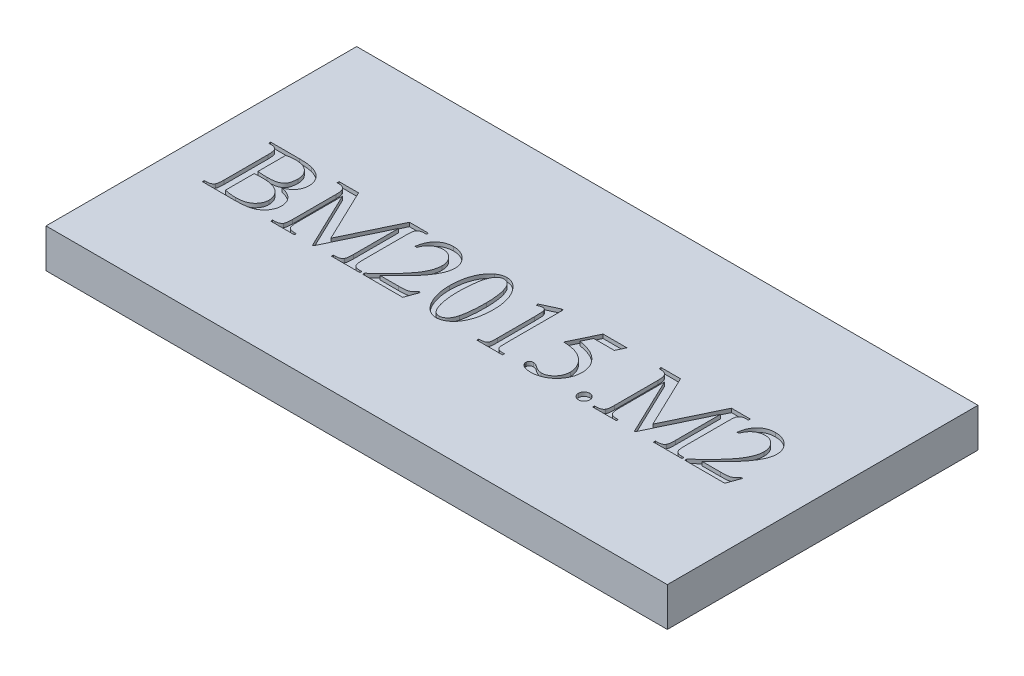
from build123d import *

# Parameters (mm, degrees)
SKETCH_1_W          = 160
SKETCH_1_H          = 80
EXTRUDE_1_DEPTH     = 10
CUT_EXTRUDE_1_DEPTH = 1


with BuildPart() as part:
    # Эскиз1 → Бобышка-Вытянуть1 (new body)
    with BuildSketch(Plane(origin=(0, 0, 0), x_dir=(1, 0, 0), z_dir=(0, 1, 0))):
        Rectangle(SKETCH_1_W, SKETCH_1_H)
    extrude(amount=EXTRUDE_1_DEPTH)

    # Эскиз2 → Вырез-Вытянуть1 (cut)
    # profile 1 of 9: a face of its own
    with BuildSketch(Plane(origin=(0, 10, 0), x_dir=(1, 0, 0), z_dir=(0, 1, 0))):
        with BuildLine():
            add(Edge.make_bspline(
                [(-58.083307054, -1.12936359), (-57.935151583, -1.162218616), (-57.647224583, -1.226069441), (-57.233701046, -1.344617735), (-56.85051146, -1.47956541), (-56.493404032, -1.623649358), (-56.164474978, -1.783325876), (-55.864999545, -1.959081857), (-55.595654967, -2.150476291), (-55.433679051, -2.291199058), (-55.354468452, -2.360016293)],
                knots=[0, 0, 0, 0, 1.202298385, 2.336560135, 3.406084711, 4.420247637, 5.386399354, 6.300522109, 7.168909389, 8, 8, 8, 8], degree=3))
            add(Edge.make_bspline(
                [(-55.354468452, -2.360016293), (-55.254240258, -2.45868109), (-55.056391441, -2.653443788), (-54.800647537, -2.975704736), (-54.585222065, -3.31438968), (-54.407168596, -3.668692158), (-54.270098938, -4.040713305), (-54.169543605, -4.428340837), (-54.111729232, -4.832307411), (-54.104533282, -5.106509479), (-54.100884332, -5.245552911)],
                knots=[0, 0, 0, 0, 1.040892545, 2.054704896, 3.038886078, 4.009403739, 4.985637774, 5.96968326, 6.970459233, 8, 8, 8, 8], degree=3))
            add(Edge.make_bspline(
                [(-54.100884332, -5.245552911), (-54.109773906, -5.459326742), (-54.127634896, -5.888842475), (-54.295807273, -6.522135238), (-54.552689425, -7.143512483), (-54.912842113, -7.737821359), (-55.35300588, -8.29336594), (-55.890156435, -8.76594946), (-56.496512251, -9.163913784), (-57.062965395, -9.427120756), (-57.567328024, -9.591580546), (-57.996528063, -9.700807422), (-58.471665181, -9.79862292), (-58.995936524, -9.865487586), (-59.565085802, -9.929753148), (-60.182391491, -9.968570826), (-60.846269083, -9.997197456), (-61.305134604, -9.999045516), (-61.542129093, -10)],
                knots=[0, 0, 0, 0, 1.028770293, 2.067011775, 3.138033473, 4.261901228, 5.406207792, 6.541562624, 7.694800496, 8.892876887, 9.539626609, 10.250184141, 11.027081459, 11.876550478, 12.796927842, 13.788050093, 14.85757392, 16, 16, 16, 16], degree=3))
            Line((-61.542129093, -10), (-69.75539822, -10))
            Line((-69.75539822, -10), (-69.75539822, -9.510796441))
            Line((-69.75539822, -9.510796441), (-69.117140452, -9.510796441))
            add(Edge.make_bspline(
                [(-69.117140452, -9.510796441), (-69.031623978, -9.508896469), (-68.866223486, -9.505221663), (-68.628601462, -9.468555371), (-68.407591735, -9.418383705), (-68.208553017, -9.33583787), (-68.025639816, -9.235762485), (-67.860349201, -9.114310171), (-67.716452197, -8.965560139), (-67.636649307, -8.85326698), (-67.596023136, -8.796100616)],
                knots=[0, 0, 0, 0, 1.166786496, 2.256723755, 3.277842578, 4.25348796, 5.187934752, 6.120436128, 7.043148905, 8, 8, 8, 8], degree=3))
            add(Edge.make_bspline(
                [(-67.596023136, -8.796100616), (-67.571713165, -8.752126879), (-67.519273623, -8.65727022), (-67.465120099, -8.488517952), (-67.415028953, -8.29096451), (-67.378860094, -8.059207847), (-67.348406901, -7.795301677), (-67.326671955, -7.498195236), (-67.310194933, -7.169426686), (-67.309659765, -6.939953985), (-67.309380425, -6.820176866)],
                knots=[0, 0, 0, 0, 0.597321695, 1.288494999, 2.101981578, 3.025155317, 4.079375286, 5.266669335, 6.573292293, 8, 8, 8, 8], degree=3))
            Line((-67.309380425, -6.820176866), (-67.309380425, 4.431504991))
            add(Edge.make_bspline(
                [(-67.309380425, 4.431504991), (-67.309187714, 4.564044157), (-67.308820582, 4.816542143), (-67.331060069, 5.175734867), (-67.353432169, 5.49775157), (-67.397357301, 5.780488463), (-67.445093055, 6.026200292), (-67.503113973, 6.234101896), (-67.579857841, 6.40226176), (-67.643258386, 6.494765474), (-67.672461192, 6.537373437)],
                knots=[0, 0, 0, 0, 1.467983741, 2.79662948, 3.986363477, 5.042318655, 5.964098798, 6.759038926, 7.428403245, 8, 8, 8, 8], degree=3))
            add(Edge.make_bspline(
                [(-67.672461192, 6.537373437), (-67.75871544, 6.62793383), (-67.93276243, 6.810669917), (-68.27906898, 6.993817977), (-68.679994602, 7.101831697), (-68.966045307, 7.115110536), (-69.117140452, 7.122124566)],
                knots=[0, 0, 0, 0, 0.927123666, 1.870784184, 2.875324672, 4, 4, 4, 4], degree=3))
            Line((-69.117140452, 7.122124566), (-69.75539822, 7.122124566))
            Line((-69.75539822, 7.122124566), (-69.75539822, 7.611328125))
            Line((-69.75539822, 7.611328125), (-62.321797265, 7.611328125))
            add(Edge.make_bspline(
                [(-62.321797265, 7.611328125), (-61.991696852, 7.608620798), (-61.366532154, 7.603493494), (-60.480230914, 7.540198231), (-59.694905134, 7.449140638), (-59.211425828, 7.343516417), (-58.985276116, 7.294110192)],
                knots=[0, 0, 0, 0, 1.179035714, 2.232931189, 3.173445281, 4, 4, 4, 4], degree=3))
            add(Edge.make_bspline(
                [(-58.985276116, 7.294110192), (-58.830475378, 7.252962713), (-58.528036356, 7.172571601), (-58.094236564, 7.017852333), (-57.687918639, 6.842263366), (-57.308550965, 6.64475572), (-56.960169398, 6.420895489), (-56.635313397, 6.180274305), (-56.341120668, 5.912497706), (-56.077791535, 5.621954778), (-55.845558733, 5.314460125), (-55.635433656, 4.998206342), (-55.46620313, 4.664377227), (-55.321125295, 4.323333768), (-55.216617894, 3.968594551), (-55.133743431, 3.605365528), (-55.088177792, 3.228770232), (-55.082276671, 2.974197134), (-55.07929145, 2.845415327)],
                knots=[0, 0, 0, 0, 1.197163213, 2.33893505, 3.43955965, 4.504702612, 5.532566955, 6.532694419, 7.523891994, 8.501634608, 9.459882266, 10.403051993, 11.336018195, 12.25408421, 13.170072591, 14.09679423, 15.037218469, 16, 16, 16, 16], degree=3))
            add(Edge.make_bspline(
                [(-55.07929145, 2.845415327), (-55.087105251, 2.626697856), (-55.102503874, 2.195672354), (-55.254775946, 1.570239949), (-55.494999798, 0.980157447), (-55.769984581, 0.520936195), (-56.040008985, 0.18304697), (-56.260992368, -0.061223322), (-56.510751786, -0.280656081), (-56.780704725, -0.486435746), (-57.075219861, -0.671124202), (-57.389016851, -0.845114708), (-57.727138198, -0.997833345), (-57.962993001, -1.084932594), (-58.083307054, -1.12936359)],
                knots=[0, 0, 0, 0, 1.471082931, 2.899056279, 4.307818116, 5.751614296, 6.484736272, 7.219614112, 7.967209451, 8.720692231, 9.503935749, 10.306636219, 11.136182697, 12, 12, 12, 12], degree=3))
        make_face()
        with BuildLine():
            add(Edge.make_bspline(
                [(-64.86336263, -0.514037238), (-64.692945887, -0.544093737), (-64.330720479, -0.607979641), (-63.74976447, -0.665695354), (-63.104427144, -0.699142348), (-62.653075855, -0.703077259), (-62.417344835, -0.705132378)],
                knots=[0, 0, 0, 0, 0.844887106, 1.795830451, 2.848809897, 4, 4, 4, 4], degree=3))
            add(Edge.make_bspline(
                [(-62.417344835, -0.705132378), (-62.264458487, -0.703354118), (-61.968755926, -0.699914726), (-61.540241642, -0.682406439), (-61.141479761, -0.646432822), (-60.77225986, -0.603915856), (-60.432400817, -0.539958425), (-60.120906283, -0.471510955), (-59.83948761, -0.381490273), (-59.509469981, -0.253532815), (-59.145320321, -0.055754639), (-58.782767834, 0.249409046), (-58.5028781, 0.615111097), (-58.309990283, 1.035402248), (-58.185415618, 1.49099766), (-58.082207176, 1.965085911), (-58.025496826, 2.460574051), (-58.018212998, 2.796874932), (-58.014512804, 2.967716217)],
                knots=[0, 0, 0, 0, 1.091830023, 2.111744693, 3.061402081, 3.95056914, 4.764258185, 5.530001833, 6.226288629, 6.871621508, 8.056545267, 9.166642, 10.231067328, 11.317616446, 12.446050905, 13.598649409, 14.780110772, 16, 16, 16, 16], degree=3))
            add(Edge.make_bspline(
                [(-58.014512804, 2.967716217), (-58.018532349, 3.100348912), (-58.026450031, 3.361608221), (-58.078788197, 3.746816082), (-58.17745199, 4.11571906), (-58.305925913, 4.471005959), (-58.472293973, 4.812706909), (-58.678876152, 5.1359246), (-58.923389495, 5.44449433), (-59.199645402, 5.737669378), (-59.513245855, 6.006493611), (-59.863872586, 6.240298016), (-60.246837904, 6.439488964), (-60.665050033, 6.600434926), (-61.115481955, 6.726083784), (-61.601863798, 6.812476281), (-62.120568156, 6.866431758), (-62.478357766, 6.873761667), (-62.661946615, 6.877522786)],
                knots=[0, 0, 0, 0, 0.932104058, 1.836054539, 2.724128921, 3.610577454, 4.48739039, 5.388899496, 6.300486582, 7.250348221, 8.215526472, 9.196272454, 10.205292906, 11.242666987, 12.339557976, 13.48617357, 14.710106481, 16, 16, 16, 16], degree=3))
            add(Edge.make_bspline(
                [(-62.661946615, 6.877522786), (-62.860795409, 6.873608591), (-63.249040527, 6.865966266), (-63.816627037, 6.813568002), (-64.353439342, 6.719038008), (-64.695808207, 6.625292952), (-64.86336263, 6.579414368)],
                knots=[0, 0, 0, 0, 1.070391011, 2.089899941, 3.065202048, 4, 4, 4, 4], degree=3))
            Line((-64.86336263, 6.579414368), (-64.86336263, -0.514037238))
        make_face(mode=Mode.SUBTRACT)
        with BuildLine():
            add(Edge.make_bspline(
                [(-64.86336263, -8.910757701), (-64.61299155, -8.966180517), (-64.114860083, -9.076448239), (-63.363817105, -9.184042878), (-62.617351025, -9.252129061), (-62.121930429, -9.261511361), (-61.874634637, -9.266194661)],
                knots=[0, 0, 0, 0, 1.019899824, 2.029164851, 3.016231376, 4, 4, 4, 4], degree=3))
            add(Edge.make_bspline(
                [(-61.874634637, -9.266194661), (-61.683369781, -9.264270033), (-61.312764466, -9.260540768), (-60.774376461, -9.2029356), (-60.270130022, -9.1230579), (-59.801690352, -9.002553889), (-59.365782736, -8.856219159), (-58.968358656, -8.667884751), (-58.604287484, -8.448091229), (-58.275754279, -8.197059756), (-57.988329946, -7.917211908), (-57.731150394, -7.625922238), (-57.51743584, -7.314627966), (-57.338767101, -6.989153368), (-57.205635762, -6.643858337), (-57.105081161, -6.286025716), (-57.046688177, -5.909925052), (-57.039679488, -5.654695807), (-57.036105686, -5.524551815)],
                knots=[0, 0, 0, 0, 1.335369974, 2.58748639, 3.778398001, 4.898614871, 5.962444548, 6.985554789, 7.963871145, 8.928614683, 9.866425566, 10.762210136, 11.638554271, 12.498661649, 13.349744001, 14.217688406, 15.091181162, 16, 16, 16, 16], degree=3))
            add(Edge.make_bspline(
                [(-57.036105686, -5.524551815), (-57.044261503, -5.352107441), (-57.060606005, -5.006523727), (-57.16883186, -4.492320686), (-57.362031352, -3.993866839), (-57.61631526, -3.505399873), (-57.950977807, -3.043834451), (-58.380301928, -2.636913587), (-58.88735204, -2.276838993), (-59.479994141, -1.978732112), (-60.147210303, -1.733123454), (-60.891331413, -1.559195298), (-61.708700466, -1.456962118), (-62.278174481, -1.445100422), (-62.57404285, -1.438937717)],
                knots=[0, 0, 0, 0, 0.80426076, 1.611762754, 2.437163379, 3.29025987, 4.174362993, 5.081949637, 6.03643416, 7.064744133, 8.166225842, 9.344998398, 10.620602567, 12, 12, 12, 12], degree=3))
            add(Edge.make_bspline(
                [(-62.57404285, -1.438937717), (-62.702722848, -1.438160339), (-62.951191532, -1.436659297), (-63.309109527, -1.447026636), (-63.637907963, -1.452656868), (-64.017637519, -1.468393209), (-64.424649074, -1.488178676), (-64.72856052, -1.536142157), (-64.86336263, -1.557416704)],
                knots=[0, 0, 0, 0, 1.009225997, 1.948718216, 2.808291512, 3.588270035, 4.930259813, 6, 6, 6, 6], degree=3))
            Line((-64.86336263, -1.557416704), (-64.86336263, -8.910757701))
        make_face(mode=Mode.SUBTRACT)
    # profile 2 of 9: a face of its own
    with BuildSketch(Plane(origin=(0, 10, 0), x_dir=(1, 0, 0), z_dir=(0, 1, 0))):
        with BuildLine():
            Line((-41.381591797, -10), (-48.475043403, 4.817517175))
            Line((-48.475043403, 4.817517175), (-48.475043403, -6.820176866))
            add(Edge.make_bspline(
                [(-48.475043403, -6.820176866), (-48.475224162, -6.955261145), (-48.475567139, -7.211573693), (-48.453681123, -7.57589808), (-48.429942711, -7.901426525), (-48.390519157, -8.186701203), (-48.348683291, -8.434798906), (-48.286350012, -8.639672396), (-48.221565226, -8.809918629), (-48.159424357, -8.900159771), (-48.13107215, -8.941332923)],
                knots=[0, 0, 0, 0, 1.48973486, 2.826663046, 4.025252461, 5.088590954, 6.003687083, 6.795186099, 7.45029523, 8, 8, 8, 8], degree=3))
            add(Edge.make_bspline(
                [(-48.13107215, -8.941332923), (-48.044633234, -9.029283516), (-47.868608314, -9.208386828), (-47.515174715, -9.388466568), (-47.099129811, -9.495079221), (-46.799236034, -9.505357239), (-46.640530056, -9.510796441)],
                knots=[0, 0, 0, 0, 0.893460505, 1.819450328, 2.846037184, 4, 4, 4, 4], degree=3))
            Line((-46.640530056, -9.510796441), (-46.029025608, -9.510796441))
            Line((-46.029025608, -9.510796441), (-46.029025608, -10))
            Line((-46.029025608, -10), (-52.144070095, -10))
            Line((-52.144070095, -10), (-52.144070095, -9.510796441))
            Line((-52.144070095, -9.510796441), (-51.532565647, -9.510796441))
            add(Edge.make_bspline(
                [(-51.532565647, -9.510796441), (-51.444512528, -9.508874283), (-51.274061196, -9.505153411), (-51.028740976, -9.468702177), (-50.802097877, -9.418104563), (-50.595868322, -9.33937337), (-50.40809511, -9.241570039), (-50.241366342, -9.118046394), (-50.09860767, -8.969822735), (-50.017862565, -8.859503545), (-49.977051205, -8.803744422)],
                knots=[0, 0, 0, 0, 1.182386838, 2.288838982, 3.326958154, 4.296765023, 5.246416275, 6.164047556, 7.072046332, 8, 8, 8, 8], degree=3))
            add(Edge.make_bspline(
                [(-49.977051205, -8.803744422), (-49.954270382, -8.762227325), (-49.904120352, -8.670830994), (-49.848621244, -8.508339338), (-49.805341866, -8.310440578), (-49.762452009, -8.080093594), (-49.732410828, -7.813218108), (-49.716775585, -7.513311385), (-49.698335248, -7.178367859), (-49.698149942, -6.943784475), (-49.6980523, -6.820176866)],
                knots=[0, 0, 0, 0, 0.561580455, 1.236271222, 2.028879402, 2.966584022, 4.017422664, 5.2149421, 6.532486222, 8, 8, 8, 8], degree=3))
            Line((-49.6980523, -6.820176866), (-49.6980523, 4.431504991))
            add(Edge.make_bspline(
                [(-49.6980523, 4.431504991), (-49.699976551, 4.621522776), (-49.703548912, 4.9742897), (-49.753858364, 5.459502225), (-49.825140608, 5.863803464), (-49.914062291, 6.093672525), (-49.954119788, 6.197224087)],
                knots=[0, 0, 0, 0, 1.269100049, 2.356076937, 3.259444487, 4, 4, 4, 4], degree=3))
            add(Edge.make_bspline(
                [(-49.954119788, 6.197224087), (-49.987685313, 6.26097027), (-50.056737383, 6.392110954), (-50.203440631, 6.567260268), (-50.390281442, 6.72258539), (-50.614620977, 6.867275248), (-50.898281446, 6.988835152), (-51.251189315, 7.067655514), (-51.673881339, 7.116087696), (-51.979566908, 7.120012469), (-52.144070095, 7.122124566)],
                knots=[0, 0, 0, 0, 0.685675889, 1.410594349, 2.160436148, 2.996293973, 3.94870651, 5.086176952, 6.431940446, 8, 8, 8, 8], degree=3))
            Line((-52.144070095, 7.122124566), (-52.144070095, 7.611328125))
            Line((-52.144070095, 7.611328125), (-47.129733615, 7.611328125))
            Line((-47.129733615, 7.611328125), (-40.578992208, -6.071083917))
            Line((-40.578992208, -6.071083917), (-34.0282508, 7.611328125))
            Line((-34.0282508, 7.611328125), (-29.151502821, 7.611328125))
            Line((-29.151502821, 7.611328125), (-29.151502821, 7.122124566))
            Line((-29.151502821, 7.122124566), (-29.751541562, 7.122124566))
            add(Edge.make_bspline(
                [(-29.751541562, 7.122124566), (-29.840881134, 7.120293258), (-30.012630645, 7.116772686), (-30.260326634, 7.079476113), (-30.488561493, 7.030130603), (-30.69581301, 6.950585862), (-30.88386158, 6.853113694), (-31.050378351, 6.728114751), (-31.197076831, 6.582509492), (-31.277924441, 6.471044301), (-31.318521712, 6.415072547)],
                knots=[0, 0, 0, 0, 1.192663738, 2.292818382, 3.341598875, 4.305885976, 5.250132179, 6.162540657, 7.077327887, 8, 8, 8, 8], degree=3))
            add(Edge.make_bspline(
                [(-31.318521712, 6.415072547), (-31.341302535, 6.37355545), (-31.391452565, 6.282159119), (-31.446951673, 6.119667463), (-31.49023105, 5.921768703), (-31.533120908, 5.691421719), (-31.563162089, 5.424546233), (-31.578797332, 5.12463951), (-31.597237669, 4.789695984), (-31.597422974, 4.5551126), (-31.597520616, 4.431504991)],
                knots=[0, 0, 0, 0, 0.561580455, 1.236271222, 2.028879402, 2.966584022, 4.017422664, 5.2149421, 6.532486222, 8, 8, 8, 8], degree=3))
            Line((-31.597520616, 4.431504991), (-31.597520616, -6.820176866))
            add(Edge.make_bspline(
                [(-31.597520616, -6.820176866), (-31.597683342, -6.955257386), (-31.597992101, -7.211562802), (-31.576334729, -7.575934845), (-31.551860101, -7.901309842), (-31.514693869, -8.187303867), (-31.465886306, -8.4341995), (-31.406224026, -8.640621855), (-31.336310192, -8.810298427), (-31.27166525, -8.900195792), (-31.242083655, -8.941332923)],
                knots=[0, 0, 0, 0, 1.486776415, 2.821049613, 4.017258766, 5.078485589, 5.994452933, 6.784380121, 7.443731031, 8, 8, 8, 8], degree=3))
            add(Edge.make_bspline(
                [(-31.242083655, -8.941332923), (-31.155718913, -9.029440256), (-30.979052652, -9.209671132), (-30.624150738, -9.386686811), (-30.209129193, -9.495788696), (-29.910324729, -9.505588745), (-29.751541562, -9.510796441)],
                knots=[0, 0, 0, 0, 0.893634595, 1.828003868, 2.845812335, 4, 4, 4, 4], degree=3))
            Line((-29.751541562, -9.510796441), (-29.151502821, -9.510796441))
            Line((-29.151502821, -9.510796441), (-29.151502821, -10))
            Line((-29.151502821, -10), (-36.489556207, -10))
            Line((-36.489556207, -10), (-36.489556207, -9.510796441))
            Line((-36.489556207, -9.510796441), (-35.878051758, -9.510796441))
            add(Edge.make_bspline(
                [(-35.878051758, -9.510796441), (-35.788729236, -9.508908991), (-35.617012503, -9.505280493), (-35.370318142, -9.468915019), (-35.142892304, -9.417114805), (-34.935344757, -9.341362154), (-34.749116434, -9.240317632), (-34.583127351, -9.11807279), (-34.440165821, -8.970838698), (-34.361884496, -8.859638089), (-34.322537316, -8.803744422)],
                knots=[0, 0, 0, 0, 1.198333024, 2.303717216, 3.340834392, 4.325725627, 5.259386468, 6.176132048, 7.08325442, 8, 8, 8, 8], degree=3))
            add(Edge.make_bspline(
                [(-34.322537316, -8.803744422), (-34.299756493, -8.762227325), (-34.249606463, -8.670830994), (-34.194107355, -8.508339338), (-34.150827978, -8.310440578), (-34.10793812, -8.080093594), (-34.077896939, -7.813218108), (-34.062261696, -7.513311385), (-34.043821359, -7.178367859), (-34.043636054, -6.943784475), (-34.043538411, -6.820176866)],
                knots=[0, 0, 0, 0, 0.561580455, 1.236271222, 2.028879402, 2.966584022, 4.017422664, 5.2149421, 6.532486222, 8, 8, 8, 8], degree=3))
            Line((-34.043538411, -6.820176866), (-34.043538411, 4.817517175))
            Line((-34.043538411, 4.817517175), (-41.136990017, -10))
            Line((-41.136990017, -10), (-41.381591797, -10))
        make_face()
    # profile 3 of 9: a face of its own
    with BuildSketch(Plane(origin=(0, 10, 0), x_dir=(1, 0, 0), z_dir=(0, 1, 0))):
        with BuildLine():
            Line((-16.921413845, -6.625259823), (-18.14060084, -10))
            Line((-18.14060084, -10), (-28.417697483, -10))
            Line((-28.417697483, -10), (-28.417697483, -9.522262149))
            add(Edge.make_bspline(
                [(-28.417697483, -9.522262149), (-28.049962701, -9.184284741), (-27.337208561, -8.529207198), (-26.317028371, -7.564400857), (-25.382387985, -6.646322311), (-24.533063777, -5.775332429), (-23.768274698, -4.952023491), (-23.089825636, -4.173799915), (-22.492136687, -3.447487308), (-21.977980964, -2.7593731), (-21.531297964, -2.10503188), (-21.152910225, -1.4657044), (-20.830235974, -0.8421502), (-20.56276819, -0.233347909), (-20.359861129, 0.364295092), (-20.213485834, 0.946947654), (-20.120603261, 1.514976731), (-20.107610584, 1.889612186), (-20.101236979, 2.073390961)],
                knots=[0, 0, 0, 0, 1.640196139, 3.179075376, 4.61094688, 5.942305235, 7.173872596, 8.30065911, 9.332401675, 10.262017718, 11.120692698, 11.932909408, 12.700076558, 13.425218913, 14.114511764, 14.770003029, 15.396620544, 16, 16, 16, 16], degree=3))
            add(Edge.make_bspline(
                [(-20.101236979, 2.073390961), (-20.10370474, 2.209869651), (-20.108542321, 2.477410385), (-20.160291182, 2.868665388), (-20.240869872, 3.241830458), (-20.349058871, 3.598074853), (-20.498284173, 3.932849655), (-20.671406647, 4.252011432), (-20.886201144, 4.547209051), (-21.124060691, 4.824611076), (-21.385867657, 5.074798563), (-21.66300152, 5.293732585), (-21.950447126, 5.483527854), (-22.252568271, 5.63743977), (-22.569317732, 5.751446209), (-22.8967657, 5.835682054), (-23.237044746, 5.892573979), (-23.469376136, 5.896919264), (-23.586812337, 5.899115668)],
                knots=[0, 0, 0, 0, 1.134419306, 2.223815103, 3.275304008, 4.307399035, 5.313221346, 6.318597171, 7.32112197, 8.342723066, 9.354331769, 10.327252885, 11.276405737, 12.214555788, 13.139633085, 14.069852934, 15.024371439, 16, 16, 16, 16], degree=3))
            add(Edge.make_bspline(
                [(-23.586812337, 5.899115668), (-23.799140972, 5.891013996), (-24.21725078, 5.875060479), (-24.824863941, 5.726892013), (-25.399228557, 5.491312143), (-25.934481849, 5.162069128), (-26.419679188, 4.742389989), (-26.841795751, 4.233577877), (-27.192538134, 3.635052479), (-27.360368563, 3.192275286), (-27.44693417, 2.963894314)],
                knots=[0, 0, 0, 0, 0.978774112, 1.927366301, 2.868767021, 3.835023234, 4.81480387, 5.817007219, 6.874029602, 8, 8, 8, 8], degree=3))
            Line((-27.44693417, 2.963894314), (-27.928493924, 2.963894314))
            add(Edge.make_bspline(
                [(-27.928493924, 2.963894314), (-27.899622971, 3.155558226), (-27.843215303, 3.53002853), (-27.710501317, 4.069536579), (-27.55258225, 4.576946559), (-27.355519174, 5.046960457), (-27.134390838, 5.487427775), (-26.878727441, 5.892127147), (-26.590404285, 6.263183943), (-26.267732069, 6.594806512), (-25.922030566, 6.893128235), (-25.552086656, 7.149704246), (-25.163924952, 7.372048836), (-24.75043071, 7.544532532), (-24.318708276, 7.684835618), (-23.866697178, 7.782294838), (-23.393748217, 7.846687545), (-23.07107543, 7.85280833), (-22.906513638, 7.855929905)],
                knots=[0, 0, 0, 0, 1.200501633, 2.345523519, 3.439068721, 4.490246694, 5.499995932, 6.48995494, 7.451685612, 8.406391985, 9.352574024, 10.27676432, 11.192316343, 12.119031984, 13.047762957, 14.001652993, 14.980851257, 16, 16, 16, 16], degree=3))
            add(Edge.make_bspline(
                [(-22.906513638, 7.855929905), (-22.73182676, 7.850989345), (-22.389023402, 7.841294053), (-21.884418405, 7.780738851), (-21.402400767, 7.672808773), (-20.940193943, 7.525111162), (-20.504405459, 7.327144342), (-20.087066374, 7.094731764), (-19.696360766, 6.811978979), (-19.330096058, 6.49413165), (-18.993587465, 6.149570204), (-18.704831758, 5.78041709), (-18.45035961, 5.402142391), (-18.254061616, 5.00159255), (-18.094499051, 4.58903364), (-17.97912917, 4.161582388), (-17.913606904, 3.716294331), (-17.904466544, 3.415089713), (-17.899820964, 3.262002733)],
                knots=[0, 0, 0, 0, 1.109419983, 2.177111989, 3.221343547, 4.242152537, 5.252521162, 6.255999647, 7.270763728, 8.308866099, 9.333003754, 10.32358272, 11.281716678, 12.222409134, 13.149434629, 14.0874794, 15.027963099, 16, 16, 16, 16], degree=3))
            add(Edge.make_bspline(
                [(-17.899820964, 3.262002733), (-17.906885075, 3.039774486), (-17.921112713, 2.592190497), (-18.047207343, 1.924911451), (-18.240045278, 1.255752628), (-18.42972743, 0.825529217), (-18.526613024, 0.605780284)],
                knots=[0, 0, 0, 0, 0.968670703, 1.950973842, 2.953401185, 4, 4, 4, 4], degree=3))
            add(Edge.make_bspline(
                [(-18.526613024, 0.605780284), (-18.610913654, 0.428757641), (-18.78282303, 0.067765657), (-19.09080369, -0.462221098), (-19.425703527, -1.004892836), (-19.797131775, -1.55723393), (-20.209623466, -2.114039465), (-20.664047598, -2.675068601), (-21.147386427, -3.250337108), (-21.49228952, -3.627566572), (-21.668217129, -3.819983164)],
                knots=[0, 0, 0, 0, 0.863272392, 1.760421205, 2.69783519, 3.672094839, 4.691137575, 5.748887515, 6.851756197, 8, 8, 8, 8], degree=3))
            add(Edge.make_bspline(
                [(-21.668217129, -3.819983164), (-21.927939485, -4.087678129), (-22.42227903, -4.597192247), (-23.128719542, -5.320150772), (-23.76605255, -5.961921808), (-24.325096361, -6.532859337), (-24.817766094, -7.021209511), (-25.239043973, -7.430554108), (-25.585947855, -7.764045295), (-25.79563336, -7.958083803), (-25.887597826, -8.043185764)],
                knots=[0, 0, 0, 0, 1.49931882, 2.853711152, 4.0632012, 5.135089847, 6.065735724, 6.851603135, 7.496332836, 8, 8, 8, 8], degree=3))
            Line((-25.887597826, -8.043185764), (-21.236342112, -8.043185764))
            add(Edge.make_bspline(
                [(-21.236342112, -8.043185764), (-21.017197625, -8.041745886), (-20.614485178, -8.039099883), (-20.062671956, -8.020081787), (-19.617193774, -7.993814419), (-19.26163778, -7.948212422), (-18.965908948, -7.880166739), (-18.699841131, -7.788563046), (-18.446139388, -7.673131375), (-18.20829291, -7.525869003), (-17.981817191, -7.351223065), (-17.774103175, -7.139737641), (-17.576851451, -6.900284294), (-17.466993092, -6.718530088), (-17.410617405, -6.625259823)],
                knots=[0, 0, 0, 0, 1.821637222, 3.347544769, 4.589491042, 5.530053278, 6.323823777, 7.107498442, 7.865641253, 8.635746017, 9.428031577, 10.236778878, 11.095173072, 12, 12, 12, 12], degree=3))
            Line((-17.410617405, -6.625259823), (-16.921413845, -6.625259823))
        make_face()
    # profile 4 of 9: a face of its own
    with BuildSketch(Plane(origin=(0, 10, 0), x_dir=(1, 0, 0), z_dir=(0, 1, 0))):
        with BuildLine():
            add(Edge.make_bspline(
                [(-14.71999783, -1.324280633), (-14.716463312, -1.079638546), (-14.709518908, -0.598980708), (-14.67262676, 0.108899861), (-14.60431309, 0.791361978), (-14.503987398, 1.446363769), (-14.382160885, 2.07666124), (-14.234859207, 2.681014159), (-14.054194106, 3.258475859), (-13.849054524, 3.808627234), (-13.617551902, 4.327053844), (-13.377520059, 4.818453922), (-13.105963534, 5.269500413), (-12.825737006, 5.69007838), (-12.526766354, 6.07700528), (-12.20291243, 6.422727906), (-11.869948706, 6.744886236), (-11.626237937, 6.928284061), (-11.505777571, 7.01893319)],
                knots=[0, 0, 0, 0, 1.267948223, 2.491187271, 3.672419621, 4.820944812, 5.924168987, 6.998668076, 8.042818115, 9.058224754, 10.039662809, 10.984530588, 11.890392543, 12.765710998, 13.603053422, 14.420720048, 15.219399938, 16, 16, 16, 16], degree=3))
            add(Edge.make_bspline(
                [(-11.505777571, 7.01893319), (-11.31960454, 7.147533712), (-10.959488199, 7.396286979), (-10.372000283, 7.657086086), (-9.77728641, 7.823851146), (-9.374209431, 7.845298919), (-9.17441686, 7.855929905)],
                knots=[0, 0, 0, 0, 1.076116545, 2.081542914, 3.049081206, 4, 4, 4, 4], degree=3))
            add(Edge.make_bspline(
                [(-9.17441686, 7.855929905), (-9.012134387, 7.850469588), (-8.689784333, 7.839623479), (-8.213989406, 7.739147568), (-7.751420934, 7.577555408), (-7.303044685, 7.349378672), (-6.867223318, 7.059280607), (-6.446228827, 6.703849965), (-6.036030137, 6.287138449), (-5.786625137, 5.972925065), (-5.658266279, 5.811211904)],
                knots=[0, 0, 0, 0, 0.921550053, 1.830522441, 2.751246923, 3.70019056, 4.682375705, 5.720881843, 6.827028318, 8, 8, 8, 8], degree=3))
            add(Edge.make_bspline(
                [(-5.658266279, 5.811211904), (-5.502362148, 5.593641132), (-5.18758535, 5.154356873), (-4.788844756, 4.433668801), (-4.459729993, 3.654101274), (-4.18117436, 2.821983027), (-3.975341736, 1.931822646), (-3.821749089, 0.98724994), (-3.729591723, -0.014085673), (-3.718564491, -0.701116264), (-3.712917752, -1.052925534)],
                knots=[0, 0, 0, 0, 0.883963831, 1.784759013, 2.714530965, 3.677036329, 4.680787027, 5.730006124, 6.837599228, 8, 8, 8, 8], degree=3))
            add(Edge.make_bspline(
                [(-3.712917752, -1.052925534), (-3.71423776, -1.301432704), (-3.716825662, -1.78863558), (-3.763128327, -2.504805296), (-3.823376957, -3.192815174), (-3.922513952, -3.851280557), (-4.037093284, -4.483908971), (-4.188695315, -5.08613273), (-4.357208489, -5.662270482), (-4.562268169, -6.203847093), (-4.78299341, -6.713317505), (-5.014882356, -7.19141007), (-5.268762012, -7.629584918), (-5.530460645, -8.036685463), (-5.809873939, -8.405102838), (-6.105757391, -8.735480764), (-6.415644104, -9.031654013), (-6.74006793, -9.289439494), (-7.067559408, -9.514747915), (-7.39561443, -9.706688045), (-7.718954396, -9.872260638), (-8.041753384, -10.005121572), (-8.358226209, -10.115879236), (-8.67407939, -10.185959839), (-8.985553079, -10.23605179), (-9.193329928, -10.241760953), (-9.29671775, -10.24460178)],
                knots=[0, 0, 0, 0, 1.510050896, 2.960482548, 4.360412811, 5.706191847, 7.006128856, 8.266230485, 9.478809624, 10.652394328, 11.782968825, 12.852979618, 13.879641343, 14.858961868, 15.792780312, 16.68657793, 17.551917979, 18.394760493, 19.202293251, 19.965865945, 20.70343888, 21.408045917, 22.086293389, 22.738035093, 23.372058038, 24, 24, 24, 24], degree=3))
            add(Edge.make_bspline(
                [(-9.29671775, -10.24460178), (-9.496306248, -10.236105273), (-9.891434928, -10.219284598), (-10.469397398, -10.0742171), (-11.022865454, -9.844109964), (-11.545281894, -9.512280361), (-12.042523337, -9.093471148), (-12.514241373, -8.583796591), (-12.95767734, -7.980958563), (-13.217150431, -7.533739377), (-13.351756626, -7.30173662)],
                knots=[0, 0, 0, 0, 0.907345466, 1.796286953, 2.695609492, 3.62566933, 4.601329434, 5.647644493, 6.779674527, 8, 8, 8, 8], degree=3))
            add(Edge.make_bspline(
                [(-13.351756626, -7.30173662), (-13.462040604, -7.091828026), (-13.684726231, -6.667980178), (-13.961211559, -5.997423386), (-14.195380691, -5.294808941), (-14.38350185, -4.560985583), (-14.539434757, -3.797580759), (-14.644672986, -3.002015534), (-14.705447758, -2.17370069), (-14.715086062, -1.611025217), (-14.71999783, -1.324280633)],
                knots=[0, 0, 0, 0, 0.917887123, 1.853399498, 2.805111979, 3.783983157, 4.785434396, 5.820907986, 6.889514713, 8, 8, 8, 8], degree=3))
        make_face()
        with BuildLine():
            add(Edge.make_bspline(
                [(-12.273980035, -1.630032857), (-12.270427448, -1.926895958), (-12.263487061, -2.506852262), (-12.227482365, -3.354829188), (-12.15762883, -4.16042021), (-12.063467509, -4.924335618), (-11.941459916, -5.647492662), (-11.794087266, -6.329409246), (-11.615164062, -6.968446087), (-11.472215616, -7.375041348), (-11.402586195, -7.573091719)],
                knots=[0, 0, 0, 0, 1.180112402, 2.305485676, 3.372849049, 4.393553838, 5.364293091, 6.287088038, 7.165649773, 8, 8, 8, 8], degree=3))
            add(Edge.make_bspline(
                [(-11.402586195, -7.573091719), (-11.342129321, -7.726170833), (-11.226760413, -8.018289315), (-11.010936193, -8.413324186), (-10.779136525, -8.751823689), (-10.51972709, -9.027048437), (-10.240078764, -9.24749024), (-9.931571336, -9.396351967), (-9.604627151, -9.494608491), (-9.377696974, -9.505340201), (-9.262320624, -9.510796441)],
                knots=[0, 0, 0, 0, 1.27796888, 2.438728037, 3.490730404, 4.457262314, 5.368188585, 6.240469892, 7.105415757, 8, 8, 8, 8], degree=3))
            add(Edge.make_bspline(
                [(-9.262320624, -9.510796441), (-9.146753759, -9.503169853), (-8.907288098, -9.487366829), (-8.550213518, -9.359330316), (-8.193443473, -9.15359115), (-7.895187724, -8.932403571), (-7.66776357, -8.707388931), (-7.496172048, -8.513156939), (-7.345818302, -8.283790008), (-7.200685156, -8.032875856), (-7.06541163, -7.754883264), (-6.945653563, -7.45000118), (-6.832627558, -7.118892102), (-6.771518279, -6.886859128), (-6.739864773, -6.766670227)],
                knots=[0, 0, 0, 0, 1.037825602, 2.150474477, 3.371635047, 4.73778764, 5.475301301, 6.247273825, 7.064217381, 7.93705097, 8.854564737, 9.842063216, 10.882227619, 12, 12, 12, 12], degree=3))
            add(Edge.make_bspline(
                [(-6.739864773, -6.766670227), (-6.691984509, -6.570915662), (-6.592086057, -6.162488968), (-6.477333168, -5.516384293), (-6.377190064, -4.814083047), (-6.299684601, -4.053984101), (-6.233777563, -3.236011408), (-6.189418723, -2.361700762), (-6.162067534, -1.430199615), (-6.160001362, -0.790508791), (-6.158935547, -0.460530599)],
                knots=[0, 0, 0, 0, 0.761713504, 1.589256053, 2.479498212, 3.443272477, 4.477217009, 5.58167292, 6.752529866, 8, 8, 8, 8], degree=3))
            add(Edge.make_bspline(
                [(-6.158935547, -0.460530599), (-6.159629382, -0.214612933), (-6.160992469, 0.268509484), (-6.194505273, 0.97695574), (-6.238412856, 1.653864493), (-6.302212834, 2.299253145), (-6.391351118, 2.911944444), (-6.493431397, 3.494930178), (-6.613993289, 4.046400029), (-6.713954078, 4.400095359), (-6.76279619, 4.572915395)],
                knots=[0, 0, 0, 0, 1.160165125, 2.279225349, 3.345596166, 4.360583534, 5.338162882, 6.266121345, 7.152804842, 8, 8, 8, 8], degree=3))
            add(Edge.make_bspline(
                [(-6.76279619, 4.572915395), (-6.801194822, 4.693040211), (-6.875691025, 4.926091294), (-7.00203939, 5.259009709), (-7.135757725, 5.565192264), (-7.275657476, 5.846504952), (-7.430158808, 6.096977413), (-7.584314416, 6.325880344), (-7.754781803, 6.522216837), (-7.876601141, 6.637665072), (-7.936120351, 6.694071452)],
                knots=[0, 0, 0, 0, 1.233545328, 2.393169741, 3.481419258, 4.501374537, 5.463177041, 6.358578008, 7.198024365, 8, 8, 8, 8], degree=3))
            add(Edge.make_bspline(
                [(-7.936120351, 6.694071452), (-8.024343064, 6.760152644), (-8.199996597, 6.891721879), (-8.506354838, 7.025200606), (-8.837527169, 7.107654336), (-9.068174051, 7.117235107), (-9.185882568, 7.122124566)],
                knots=[0, 0, 0, 0, 0.978770933, 1.948756365, 2.953166656, 4, 4, 4, 4], degree=3))
            add(Edge.make_bspline(
                [(-9.185882568, 7.122124566), (-9.326141088, 7.112696826), (-9.607122944, 7.093810103), (-10.010568301, 6.93379536), (-10.387312521, 6.677668922), (-10.599300107, 6.447994887), (-10.710821788, 6.327168783)],
                knots=[0, 0, 0, 0, 0.945219573, 1.893571615, 2.891857598, 4, 4, 4, 4], degree=3))
            add(Edge.make_bspline(
                [(-10.710821788, 6.327168783), (-10.785441112, 6.231751638), (-10.938327755, 6.036252589), (-11.136380874, 5.705511462), (-11.320608916, 5.339968741), (-11.478702142, 4.931451834), (-11.623386436, 4.487327388), (-11.755362842, 4.004767909), (-11.858409166, 3.481613577), (-11.979365136, 2.738224876), (-12.098140853, 1.786537842), (-12.193307188, 0.641310564), (-12.26529688, -0.496570254), (-12.271090348, -1.25282525), (-12.273980035, -1.630032857)],
                knots=[0, 0, 0, 0, 0.529149883, 1.084168889, 1.682003891, 2.317081463, 2.996986461, 3.723908646, 4.502772949, 5.326906926, 7.016784336, 8.694047759, 10.351045161, 12, 12, 12, 12], degree=3))
        make_face(mode=Mode.SUBTRACT)
    # profile 5 of 9: a face of its own
    with BuildSketch(Plane(origin=(0, 10, 0), x_dir=(1, 0, 0), z_dir=(0, 1, 0))):
        with BuildLine():
            Line((0.68991428, 5.899115668), (4.897829268, 7.855929905))
            Line((4.897829268, 7.855929905), (5.33734809, 7.855929905))
            Line((5.33734809, 7.855929905), (5.33734809, -6.820176866))
            add(Edge.make_bspline(
                [(5.33734809, -6.820176866), (5.338865316, -6.94119563), (5.341740078, -7.170495834), (5.342102563, -7.496806078), (5.356987855, -7.785798922), (5.364248378, -8.039794341), (5.386740702, -8.257206428), (5.401639981, -8.441650521), (5.429787182, -8.589065411), (5.462450074, -8.738106942), (5.529761526, -8.890489327), (5.643939018, -9.047332516), (5.791464278, -9.180936335), (5.979239189, -9.301947197), (6.239477109, -9.386931689), (6.584318375, -9.452873892), (7.028274202, -9.495313531), (7.357773249, -9.505307076), (7.538764106, -9.510796441)],
                knots=[0, 0, 0, 0, 1.356933168, 2.571048021, 3.657379777, 4.601012336, 5.418253307, 6.107533085, 6.673460353, 7.099554724, 7.815972102, 8.521630774, 9.259509655, 10.036179522, 11.007509208, 12.304408113, 13.970044684, 16, 16, 16, 16], degree=3))
            Line((7.538764106, -9.510796441), (7.538764106, -10))
            Line((7.538764106, -10), (0.934516059, -10))
            Line((0.934516059, -10), (0.934516059, -9.510796441))
            add(Edge.make_bspline(
                [(0.934516059, -9.510796441), (1.119358656, -9.505547272), (1.454004337, -9.496043987), (1.901259925, -9.451719967), (2.241652704, -9.392437482), (2.491921338, -9.309344095), (2.664750121, -9.191038199), (2.80594145, -9.070495828), (2.913414102, -8.927970171), (2.990251767, -8.795243027), (3.035104864, -8.659344623), (3.057753732, -8.514845002), (3.087031097, -8.331957612), (3.102810184, -8.107006082), (3.118418554, -7.842062283), (3.13053365, -7.537520867), (3.131738522, -7.19216767), (3.134481571, -6.948844414), (3.135932075, -6.820176866)],
                knots=[0, 0, 0, 0, 2.071302469, 3.74996044, 5.029173581, 5.941282905, 6.673651071, 7.361112001, 8.012044112, 8.663601818, 9.069808009, 9.607263055, 10.29959599, 11.144699654, 12.131164582, 13.273777592, 14.558393644, 16, 16, 16, 16], degree=3))
            Line((3.135932075, -6.820176866), (3.135932075, 2.719292535))
            add(Edge.make_bspline(
                [(3.135932075, 2.719292535), (3.13678555, 2.861987852), (3.138416447, 3.134662813), (3.127379242, 3.524408011), (3.123968946, 3.87500229), (3.105095677, 4.18431461), (3.094098672, 4.453703488), (3.0679679, 4.681236189), (3.049663669, 4.87106125), (3.024752406, 4.982011728), (3.013631185, 5.031543732)],
                knots=[0, 0, 0, 0, 1.476765178, 2.821934835, 4.035278551, 5.104597693, 6.029081604, 6.824151588, 7.47506195, 8, 8, 8, 8], degree=3))
            add(Edge.make_bspline(
                [(3.013631185, 5.031543732), (2.997414931, 5.093214322), (2.966676299, 5.210113672), (2.897186859, 5.370584922), (2.808567208, 5.507095778), (2.6680286, 5.65268389), (2.446409033, 5.784375661), (2.247422734, 5.80215508), (2.146059248, 5.811211904)],
                knots=[0, 0, 0, 0, 0.903062441, 1.711795068, 2.468214314, 3.196286531, 4.571790261, 6, 6, 6, 6], degree=3))
            add(Edge.make_bspline(
                [(2.146059248, 5.811211904), (2.062932455, 5.804423211), (1.877726938, 5.789298084), (1.579671072, 5.711948477), (1.23847836, 5.582491261), (1.001238306, 5.470354154), (0.873365614, 5.409912109)],
                knots=[0, 0, 0, 0, 0.743837888, 1.657262055, 2.737261251, 4, 4, 4, 4], degree=3))
            Line((0.873365614, 5.409912109), (0.68991428, 5.899115668))
        make_face()
    # profile 6 of 9: a face of its own
    with BuildSketch(Plane(origin=(0, 10, 0), x_dir=(1, 0, 0), z_dir=(0, 1, 0))):
        with BuildLine():
            Line((21.970269097, 7.611328125), (20.953642951, 5.409912109))
            Line((20.953642951, 5.409912109), (15.637376149, 5.409912109))
            Line((15.637376149, 5.409912109), (14.460230086, 3.009757148))
            add(Edge.make_bspline(
                [(14.460230086, 3.009757148), (14.761661027, 2.964291131), (15.350419236, 2.87548641), (16.198051455, 2.675103694), (16.990825509, 2.431280715), (17.726169497, 2.139103929), (18.402964327, 1.792444081), (19.023926022, 1.40229514), (19.593500616, 0.967975102), (19.925282361, 0.633926847), (20.089892917, 0.468191783)],
                knots=[0, 0, 0, 0, 1.161098856, 2.267870976, 3.314957367, 4.319094488, 5.278631444, 6.207879786, 7.110855526, 8, 8, 8, 8], degree=3))
            add(Edge.make_bspline(
                [(20.089892917, 0.468191783), (20.220147181, 0.321450019), (20.477212108, 0.031845982), (20.809123405, -0.43799232), (21.096285893, -0.924495254), (21.323374981, -1.434835901), (21.507288626, -1.961967627), (21.630293509, -2.50968818), (21.71034884, -3.076179944), (21.720507188, -3.460445979), (21.725667318, -3.655641344)],
                knots=[0, 0, 0, 0, 1.034913379, 2.042466206, 3.030809393, 4.011898082, 4.985794297, 5.972603802, 6.970144889, 8, 8, 8, 8], degree=3))
            add(Edge.make_bspline(
                [(21.725667318, -3.655641344), (21.718975189, -3.881508033), (21.705789245, -4.326548169), (21.603559297, -4.981506069), (21.436732396, -5.611597362), (21.19682578, -6.209332168), (20.911236966, -6.771621303), (20.589464879, -7.295809772), (20.228976893, -7.774851944), (19.834510639, -8.210480223), (19.413312612, -8.604759742), (18.968223843, -8.959002804), (18.497603045, -9.269210592), (18.167618969, -9.445736269), (18.003133986, -9.533727858)],
                knots=[0, 0, 0, 0, 1.1099864, 2.187079908, 3.250539699, 4.307729047, 5.34688064, 6.348023694, 7.327560577, 8.289805641, 9.233611556, 10.160876763, 11.083264383, 12, 12, 12, 12], degree=3))
            add(Edge.make_bspline(
                [(18.003133986, -9.533727858), (17.765868034, -9.642667945), (17.298350274, -9.857327594), (16.564708923, -10.0768505), (15.823686825, -10.217402236), (15.324602215, -10.2355473), (15.075556437, -10.24460178)],
                knots=[0, 0, 0, 0, 1.030129172, 2.029805285, 3.016862743, 4, 4, 4, 4], degree=3))
            add(Edge.make_bspline(
                [(15.075556437, -10.24460178), (14.953167182, -10.243838379), (14.718257811, -10.242373136), (14.378210215, -10.211574477), (14.063252974, -10.178463896), (13.774145215, -10.118239573), (13.510033879, -10.0502513), (13.27514633, -9.953233453), (13.059144453, -9.855964733), (12.822175238, -9.692342567), (12.573705497, -9.478074074), (12.354249866, -9.190767633), (12.209833449, -8.88766913), (12.193999158, -8.675258744), (12.186197917, -8.570608351)],
                knots=[0, 0, 0, 0, 1.193262804, 2.290304112, 3.329214677, 4.279706917, 5.169093206, 5.983709925, 6.756293359, 7.473199502, 8.784894099, 9.938141948, 10.984163348, 12, 12, 12, 12], degree=3))
            add(Edge.make_bspline(
                [(12.186197917, -8.570608351), (12.190091187, -8.512890754), (12.197791305, -8.398736751), (12.253353845, -8.233107595), (12.349726568, -8.082322826), (12.473884502, -7.941453542), (12.629405713, -7.823289086), (12.808467602, -7.740314633), (13.004257024, -7.681617278), (13.142479788, -7.678106847), (13.214289771, -7.676283095)],
                knots=[0, 0, 0, 0, 0.916128209, 1.811920583, 2.738491236, 3.74165137, 4.781681047, 5.813410906, 6.864015437, 8, 8, 8, 8], degree=3))
            add(Edge.make_bspline(
                [(13.214289771, -7.676283095), (13.318047672, -7.680828349), (13.513488268, -7.689389888), (13.7549044, -7.759622314), (13.950860683, -7.855720158), (14.1417893, -7.962883659), (14.373319257, -8.113709349), (14.54077567, -8.228776634), (14.632215712, -8.291609446)],
                knots=[0, 0, 0, 0, 1.184038934, 2.230281013, 2.842640406, 3.677218206, 4.731638514, 6, 6, 6, 6], degree=3))
            add(Edge.make_bspline(
                [(14.632215712, -8.291609446), (14.784135061, -8.392261592), (15.079677663, -8.588069416), (15.548047186, -8.810403991), (16.020026153, -8.963152287), (16.339614664, -9.002284486), (16.497304281, -9.021592882)],
                knots=[0, 0, 0, 0, 1.077967054, 2.097067893, 3.06106564, 4, 4, 4, 4], degree=3))
            add(Edge.make_bspline(
                [(16.497304281, -9.021592882), (16.614722232, -9.017700253), (16.848215694, -9.009959499), (17.191406095, -8.954791111), (17.526148628, -8.86820986), (17.845129088, -8.734617347), (18.158785116, -8.57553016), (18.456691752, -8.372543111), (18.749220002, -8.141223318), (19.020650269, -7.868743243), (19.274325504, -7.577251277), (19.494707509, -7.262857445), (19.682575692, -6.934481452), (19.835988005, -6.588698267), (19.955403267, -6.227686124), (20.0378826, -5.849731199), (20.094838488, -5.45748668), (20.099170613, -5.189705295), (20.101358626, -5.05445777)],
                knots=[0, 0, 0, 0, 0.947900043, 1.884962737, 2.800832902, 3.733139476, 4.671838567, 5.636287641, 6.638887168, 7.679204741, 8.737077399, 9.75606472, 10.774376646, 11.787634885, 12.805946811, 13.839271517, 14.908687479, 16, 16, 16, 16], degree=3))
            add(Edge.make_bspline(
                [(20.101358626, -5.05445777), (20.098402216, -4.921842525), (20.092528411, -4.658362076), (20.045748657, -4.265611022), (19.965525931, -3.880986189), (19.853225483, -3.502996185), (19.710960533, -3.131444257), (19.54018255, -2.765177808), (19.334769815, -2.406674385), (19.100042595, -2.057650632), (18.834722195, -1.723558128), (18.55418171, -1.399402557), (18.241608474, -1.101044773), (17.906617961, -0.823140516), (17.546952519, -0.565258039), (17.16651534, -0.324535845), (16.759789306, -0.10606106), (16.476450103, 0.021435263), (16.33296246, 0.086001502)],
                knots=[0, 0, 0, 0, 0.942313198, 1.872191274, 2.806203531, 3.731530393, 4.671491833, 5.631430359, 6.600590081, 7.605054811, 8.617526285, 9.631090202, 10.649213475, 11.684423761, 12.72220443, 13.792302564, 14.88198562, 16, 16, 16, 16], degree=3))
            add(Edge.make_bspline(
                [(16.33296246, 0.086001502), (16.212486633, 0.13341992), (15.965238571, 0.230734976), (15.571145185, 0.35112763), (15.148667459, 0.463446684), (14.691296272, 0.553422789), (14.204164856, 0.62909265), (13.68531025, 0.690131005), (13.135903275, 0.73604613), (12.758283303, 0.753516231), (12.564566294, 0.762478299)],
                knots=[0, 0, 0, 0, 0.807230533, 1.656649213, 2.568235188, 3.532821807, 4.562222431, 5.642410622, 6.790569369, 8, 8, 8, 8], degree=3))
            Line((12.564566294, 0.762478299), (15.843758901, 7.611328125))
            Line((15.843758901, 7.611328125), (21.970269097, 7.611328125))
        make_face()
    # profile 7 of 9: a face of its own
    with BuildSketch(Plane(origin=(0, 10, 0), x_dir=(1, 0, 0), z_dir=(0, 1, 0))):
        with BuildLine():
            add(Edge.make_bspline(
                [(27.351508247, -7.309380425), (27.451405424, -7.314336322), (27.646973091, -7.32403843), (27.928314798, -7.406071837), (28.18051005, -7.547451466), (28.400800758, -7.736515988), (28.589248439, -7.956965295), (28.719131763, -8.21178063), (28.805626133, -8.48605542), (28.814537674, -8.678208808), (28.819118924, -8.776991102)],
                knots=[0, 0, 0, 0, 1.037275406, 2.030663297, 3.014825024, 4.020499098, 5.036326932, 6.007930485, 6.975916064, 8, 8, 8, 8], degree=3))
            add(Edge.make_bspline(
                [(28.819118924, -8.776991102), (28.814407155, -8.875702541), (28.805241724, -9.067718097), (28.719883503, -9.34522898), (28.581234931, -9.598008608), (28.393367994, -9.822599509), (28.170329155, -10.010006143), (27.917877253, -10.14550303), (27.642288706, -10.230824623), (27.450237838, -10.239923979), (27.351508247, -10.24460178)],
                knots=[0, 0, 0, 0, 1.025445604, 1.994718261, 2.991811449, 4.008989973, 5.026168498, 6.005281739, 6.974554396, 8, 8, 8, 8], degree=3))
            add(Edge.make_bspline(
                [(27.351508247, -10.24460178), (27.252746947, -10.239981285), (27.060634398, -10.230993402), (26.784408251, -10.144529401), (26.529367742, -10.011316574), (26.306214042, -9.822285307), (26.117182775, -9.599131606), (25.983969948, -9.344091098), (25.897505947, -9.067864951), (25.888518064, -8.875752402), (25.883897569, -8.776991102)],
                knots=[0, 0, 0, 0, 1.024751981, 1.993369011, 2.983509506, 4, 5.016490494, 6.006630989, 6.975248019, 8, 8, 8, 8], degree=3))
            add(Edge.make_bspline(
                [(25.883897569, -8.776991102), (25.88875975, -8.677041898), (25.898278391, -8.481372377), (25.981463604, -8.201358461), (26.117391279, -7.946863378), (26.307594732, -7.728011501), (26.528178959, -7.537939466), (26.78554919, -7.410339133), (27.060482559, -7.322706532), (27.252695392, -7.31390508), (27.351508247, -7.309380425)],
                knots=[0, 0, 0, 0, 1.036574804, 2.029291735, 3.006444391, 4.011439207, 5.026580925, 6.009275979, 6.976607756, 8, 8, 8, 8], degree=3))
        make_face()
    # profile 8 of 9: a face of its own
    with BuildSketch(Plane(origin=(0, 10, 0), x_dir=(1, 0, 0), z_dir=(0, 1, 0))):
        with BuildLine():
            Line((41.538411458, -10), (34.444959852, 4.817517175))
            Line((34.444959852, 4.817517175), (34.444959852, -6.820176866))
            add(Edge.make_bspline(
                [(34.444959852, -6.820176866), (34.444779093, -6.955261145), (34.444436116, -7.211573693), (34.466322132, -7.57589808), (34.490060545, -7.901426525), (34.529484098, -8.186701203), (34.571319964, -8.434798906), (34.633653244, -8.639672396), (34.698438029, -8.809918629), (34.760578899, -8.900159771), (34.788931105, -8.941332923)],
                knots=[0, 0, 0, 0, 1.48973486, 2.826663046, 4.025252461, 5.088590954, 6.003687083, 6.795186099, 7.45029523, 8, 8, 8, 8], degree=3))
            add(Edge.make_bspline(
                [(34.788931105, -8.941332923), (34.875370021, -9.029283516), (35.051394941, -9.208386828), (35.40482854, -9.388466568), (35.820873444, -9.495079221), (36.120767221, -9.505357239), (36.279473199, -9.510796441)],
                knots=[0, 0, 0, 0, 0.893460505, 1.819450328, 2.846037184, 4, 4, 4, 4], degree=3))
            Line((36.279473199, -9.510796441), (36.890977648, -9.510796441))
            Line((36.890977648, -9.510796441), (36.890977648, -10))
            Line((36.890977648, -10), (30.77593316, -10))
            Line((30.77593316, -10), (30.77593316, -9.510796441))
            Line((30.77593316, -9.510796441), (31.387437609, -9.510796441))
            add(Edge.make_bspline(
                [(31.387437609, -9.510796441), (31.475490728, -9.508874283), (31.64594206, -9.505153411), (31.891262279, -9.468702177), (32.117905379, -9.418104563), (32.324134933, -9.33937337), (32.511908145, -9.241570039), (32.678636913, -9.118046394), (32.821395586, -8.969822735), (32.90214069, -8.859503545), (32.94295205, -8.803744422)],
                knots=[0, 0, 0, 0, 1.182386838, 2.288838982, 3.326958154, 4.296765023, 5.246416275, 6.164047556, 7.072046332, 8, 8, 8, 8], degree=3))
            add(Edge.make_bspline(
                [(32.94295205, -8.803744422), (32.965732874, -8.762227325), (33.015882903, -8.670830994), (33.071382011, -8.508339338), (33.114661389, -8.310440578), (33.157551246, -8.080093594), (33.187592427, -7.813218108), (33.20322767, -7.513311385), (33.221668007, -7.178367859), (33.221853313, -6.943784475), (33.221950955, -6.820176866)],
                knots=[0, 0, 0, 0, 0.561580455, 1.236271222, 2.028879402, 2.966584022, 4.017422664, 5.2149421, 6.532486222, 8, 8, 8, 8], degree=3))
            Line((33.221950955, -6.820176866), (33.221950955, 4.431504991))
            add(Edge.make_bspline(
                [(33.221950955, 4.431504991), (33.220026704, 4.621522776), (33.216454343, 4.9742897), (33.166144891, 5.459502225), (33.094862647, 5.863803464), (33.005940964, 6.093672525), (32.965883467, 6.197224087)],
                knots=[0, 0, 0, 0, 1.269100049, 2.356076937, 3.259444487, 4, 4, 4, 4], degree=3))
            add(Edge.make_bspline(
                [(32.965883467, 6.197224087), (32.932317942, 6.26097027), (32.863265872, 6.392110954), (32.716562625, 6.567260268), (32.529721813, 6.72258539), (32.305382279, 6.867275248), (32.02172181, 6.988835152), (31.668813941, 7.067655514), (31.246121917, 7.116087696), (30.940436347, 7.120012469), (30.77593316, 7.122124566)],
                knots=[0, 0, 0, 0, 0.685675889, 1.410594349, 2.160436148, 2.996293973, 3.94870651, 5.086176952, 6.431940446, 8, 8, 8, 8], degree=3))
            Line((30.77593316, 7.122124566), (30.77593316, 7.611328125))
            Line((30.77593316, 7.611328125), (35.79026964, 7.611328125))
            Line((35.79026964, 7.611328125), (42.341011047, -6.071083917))
            Line((42.341011047, -6.071083917), (48.891752455, 7.611328125))
            Line((48.891752455, 7.611328125), (53.768500434, 7.611328125))
            Line((53.768500434, 7.611328125), (53.768500434, 7.122124566))
            Line((53.768500434, 7.122124566), (53.168461694, 7.122124566))
            add(Edge.make_bspline(
                [(53.168461694, 7.122124566), (53.079122121, 7.120293258), (52.90737261, 7.116772686), (52.659676621, 7.079476113), (52.431441762, 7.030130603), (52.224190246, 6.950585862), (52.036141675, 6.853113694), (51.869624904, 6.728114751), (51.722926424, 6.582509492), (51.642078815, 6.471044301), (51.601481544, 6.415072547)],
                knots=[0, 0, 0, 0, 1.192663738, 2.292818382, 3.341598875, 4.305885976, 5.250132179, 6.162540657, 7.077327887, 8, 8, 8, 8], degree=3))
            add(Edge.make_bspline(
                [(51.601481544, 6.415072547), (51.57870072, 6.37355545), (51.528550691, 6.282159119), (51.473051583, 6.119667463), (51.429772205, 5.921768703), (51.386882347, 5.691421719), (51.356841167, 5.424546233), (51.341205923, 5.12463951), (51.322765587, 4.789695984), (51.322580281, 4.5551126), (51.322482639, 4.431504991)],
                knots=[0, 0, 0, 0, 0.561580455, 1.236271222, 2.028879402, 2.966584022, 4.017422664, 5.2149421, 6.532486222, 8, 8, 8, 8], degree=3))
            Line((51.322482639, 4.431504991), (51.322482639, -6.820176866))
            add(Edge.make_bspline(
                [(51.322482639, -6.820176866), (51.322319914, -6.955257386), (51.322011155, -7.211562802), (51.343668526, -7.575934845), (51.368143154, -7.901309842), (51.405309386, -8.187303867), (51.454116949, -8.4341995), (51.513779229, -8.640621855), (51.583693064, -8.810298427), (51.648338005, -8.900195792), (51.6779196, -8.941332923)],
                knots=[0, 0, 0, 0, 1.486776415, 2.821049613, 4.017258766, 5.078485589, 5.994452933, 6.784380121, 7.443731031, 8, 8, 8, 8], degree=3))
            add(Edge.make_bspline(
                [(51.6779196, -8.941332923), (51.764284342, -9.029440256), (51.940950603, -9.209671132), (52.295852517, -9.386686811), (52.710874062, -9.495788696), (53.009678526, -9.505588745), (53.168461694, -9.510796441)],
                knots=[0, 0, 0, 0, 0.893634595, 1.828003868, 2.845812335, 4, 4, 4, 4], degree=3))
            Line((53.168461694, -9.510796441), (53.768500434, -9.510796441))
            Line((53.768500434, -9.510796441), (53.768500434, -10))
            Line((53.768500434, -10), (46.430447049, -10))
            Line((46.430447049, -10), (46.430447049, -9.510796441))
            Line((46.430447049, -9.510796441), (47.041951497, -9.510796441))
            add(Edge.make_bspline(
                [(47.041951497, -9.510796441), (47.131274019, -9.508908991), (47.302990752, -9.505280493), (47.549685113, -9.468915019), (47.777110951, -9.417114805), (47.984658499, -9.341362154), (48.170886821, -9.240317632), (48.336875904, -9.11807279), (48.479837434, -8.970838698), (48.55811876, -8.859638089), (48.597465939, -8.803744422)],
                knots=[0, 0, 0, 0, 1.198333024, 2.303717216, 3.340834392, 4.325725627, 5.259386468, 6.176132048, 7.08325442, 8, 8, 8, 8], degree=3))
            add(Edge.make_bspline(
                [(48.597465939, -8.803744422), (48.620246762, -8.762227325), (48.670396792, -8.670830994), (48.7258959, -8.508339338), (48.769175278, -8.310440578), (48.812065135, -8.080093594), (48.842106316, -7.813218108), (48.857741559, -7.513311385), (48.876181896, -7.178367859), (48.876367202, -6.943784475), (48.876464844, -6.820176866)],
                knots=[0, 0, 0, 0, 0.561580455, 1.236271222, 2.028879402, 2.966584022, 4.017422664, 5.2149421, 6.532486222, 8, 8, 8, 8], degree=3))
            Line((48.876464844, -6.820176866), (48.876464844, 4.817517175))
            Line((48.876464844, 4.817517175), (41.783013238, -10))
            Line((41.783013238, -10), (41.538411458, -10))
        make_face()
    # profile 9 of 9: a face of its own
    with BuildSketch(Plane(origin=(0, 10, 0), x_dir=(1, 0, 0), z_dir=(0, 1, 0))):
        with BuildLine():
            Line((65.99858941, -6.625259823), (64.779402415, -10))
            Line((64.779402415, -10), (54.502305773, -10))
            Line((54.502305773, -10), (54.502305773, -9.522262149))
            add(Edge.make_bspline(
                [(54.502305773, -9.522262149), (54.870040554, -9.184284741), (55.582794694, -8.529207198), (56.602974884, -7.564400857), (57.53761527, -6.646322311), (58.386939478, -5.775332429), (59.151728557, -4.952023491), (59.830177619, -4.173799915), (60.427866568, -3.447487308), (60.942022291, -2.7593731), (61.388705291, -2.10503188), (61.76709303, -1.4657044), (62.089767281, -0.8421502), (62.357235065, -0.233347909), (62.560142126, 0.364295092), (62.706517421, 0.946947654), (62.799399994, 1.514976731), (62.812392671, 1.889612186), (62.818766276, 2.073390961)],
                knots=[0, 0, 0, 0, 1.640196139, 3.179075376, 4.61094688, 5.942305235, 7.173872596, 8.30065911, 9.332401675, 10.262017718, 11.120692698, 11.932909408, 12.700076558, 13.425218913, 14.114511764, 14.770003029, 15.396620544, 16, 16, 16, 16], degree=3))
            add(Edge.make_bspline(
                [(62.818766276, 2.073390961), (62.816298515, 2.209869651), (62.811460935, 2.477410385), (62.759712073, 2.868665388), (62.679133383, 3.241830458), (62.570944384, 3.598074853), (62.421719082, 3.932849655), (62.248596608, 4.252011432), (62.033802111, 4.547209051), (61.795942564, 4.824611076), (61.534135598, 5.074798563), (61.257001735, 5.293732585), (60.969556129, 5.483527854), (60.667434984, 5.63743977), (60.350685523, 5.751446209), (60.023237555, 5.835682054), (59.682958509, 5.892573979), (59.450627119, 5.896919264), (59.333190918, 5.899115668)],
                knots=[0, 0, 0, 0, 1.134419306, 2.223815103, 3.275304008, 4.307399035, 5.313221346, 6.318597171, 7.32112197, 8.342723066, 9.354331769, 10.327252885, 11.276405737, 12.214555788, 13.139633085, 14.069852934, 15.024371439, 16, 16, 16, 16], degree=3))
            add(Edge.make_bspline(
                [(59.333190918, 5.899115668), (59.120862283, 5.891013996), (58.702752475, 5.875060479), (58.095139314, 5.726892013), (57.520774699, 5.491312143), (56.985521406, 5.162069128), (56.500324067, 4.742389989), (56.078207504, 4.233577877), (55.727465121, 3.635052479), (55.559634692, 3.192275286), (55.473069085, 2.963894314)],
                knots=[0, 0, 0, 0, 0.978774112, 1.927366301, 2.868767021, 3.835023234, 4.81480387, 5.817007219, 6.874029602, 8, 8, 8, 8], degree=3))
            Line((55.473069085, 2.963894314), (54.991509332, 2.963894314))
            add(Edge.make_bspline(
                [(54.991509332, 2.963894314), (55.020380284, 3.155558226), (55.076787952, 3.53002853), (55.209501938, 4.069536579), (55.367421005, 4.576946559), (55.564484081, 5.046960457), (55.785612417, 5.487427775), (56.041275815, 5.892127147), (56.329598971, 6.263183943), (56.652271186, 6.594806512), (56.99797269, 6.893128235), (57.367916599, 7.149704246), (57.756078303, 7.372048836), (58.169572545, 7.544532532), (58.601294979, 7.684835618), (59.053306077, 7.782294838), (59.526255039, 7.846687545), (59.848927825, 7.85280833), (60.013489617, 7.855929905)],
                knots=[0, 0, 0, 0, 1.200501633, 2.345523519, 3.439068721, 4.490246694, 5.499995932, 6.48995494, 7.451685612, 8.406391985, 9.352574024, 10.27676432, 11.192316343, 12.119031984, 13.047762957, 14.001652993, 14.980851257, 16, 16, 16, 16], degree=3))
            add(Edge.make_bspline(
                [(60.013489617, 7.855929905), (60.188176495, 7.850989345), (60.530979853, 7.841294053), (61.03558485, 7.780738851), (61.517602489, 7.672808773), (61.979809312, 7.525111162), (62.415597796, 7.327144342), (62.832936881, 7.094731764), (63.223642489, 6.811978979), (63.589907197, 6.49413165), (63.92641579, 6.149570204), (64.215171497, 5.78041709), (64.469643645, 5.402142391), (64.665941639, 5.00159255), (64.825504204, 4.58903364), (64.940874085, 4.161582388), (65.006396351, 3.716294331), (65.015536711, 3.415089713), (65.020182292, 3.262002733)],
                knots=[0, 0, 0, 0, 1.109419983, 2.177111989, 3.221343547, 4.242152537, 5.252521162, 6.255999647, 7.270763728, 8.308866099, 9.333003754, 10.32358272, 11.281716678, 12.222409134, 13.149434629, 14.0874794, 15.027963099, 16, 16, 16, 16], degree=3))
            add(Edge.make_bspline(
                [(65.020182292, 3.262002733), (65.01311818, 3.039774486), (64.998890542, 2.592190497), (64.872795913, 1.924911451), (64.679957977, 1.255752628), (64.490275825, 0.825529217), (64.393390232, 0.605780284)],
                knots=[0, 0, 0, 0, 0.968670703, 1.950973842, 2.953401185, 4, 4, 4, 4], degree=3))
            add(Edge.make_bspline(
                [(64.393390232, 0.605780284), (64.309089601, 0.428757641), (64.137180226, 0.067765657), (63.829199565, -0.462221098), (63.494299728, -1.004892836), (63.122871481, -1.55723393), (62.710379789, -2.114039465), (62.255955658, -2.675068601), (61.772616828, -3.250337108), (61.427713736, -3.627566572), (61.251786126, -3.819983164)],
                knots=[0, 0, 0, 0, 0.863272392, 1.760421205, 2.69783519, 3.672094839, 4.691137575, 5.748887515, 6.851756197, 8, 8, 8, 8], degree=3))
            add(Edge.make_bspline(
                [(61.251786126, -3.819983164), (60.99206377, -4.087678129), (60.497724225, -4.597192247), (59.791283713, -5.320150772), (59.153950705, -5.961921808), (58.594906894, -6.532859337), (58.102237162, -7.021209511), (57.680959283, -7.430554108), (57.3340554, -7.764045295), (57.124369895, -7.958083803), (57.032405429, -8.043185764)],
                knots=[0, 0, 0, 0, 1.49931882, 2.853711152, 4.0632012, 5.135089847, 6.065735724, 6.851603135, 7.496332836, 8, 8, 8, 8], degree=3))
            Line((57.032405429, -8.043185764), (61.683661143, -8.043185764))
            add(Edge.make_bspline(
                [(61.683661143, -8.043185764), (61.90280563, -8.041745886), (62.305518077, -8.039099883), (62.8573313, -8.020081787), (63.302809481, -7.993814419), (63.658365475, -7.948212422), (63.954094307, -7.880166739), (64.220162124, -7.788563046), (64.473863868, -7.673131375), (64.711710345, -7.525869003), (64.938186065, -7.351223065), (65.14590008, -7.139737641), (65.343151804, -6.900284294), (65.453010164, -6.718530088), (65.509385851, -6.625259823)],
                knots=[0, 0, 0, 0, 1.821637222, 3.347544769, 4.589491042, 5.530053278, 6.323823777, 7.107498442, 7.865641253, 8.635746017, 9.428031577, 10.236778878, 11.095173072, 12, 12, 12, 12], degree=3))
            Line((65.509385851, -6.625259823), (65.99858941, -6.625259823))
        make_face()
    extrude(amount=-CUT_EXTRUDE_1_DEPTH, mode=Mode.SUBTRACT)


solid = part.part
